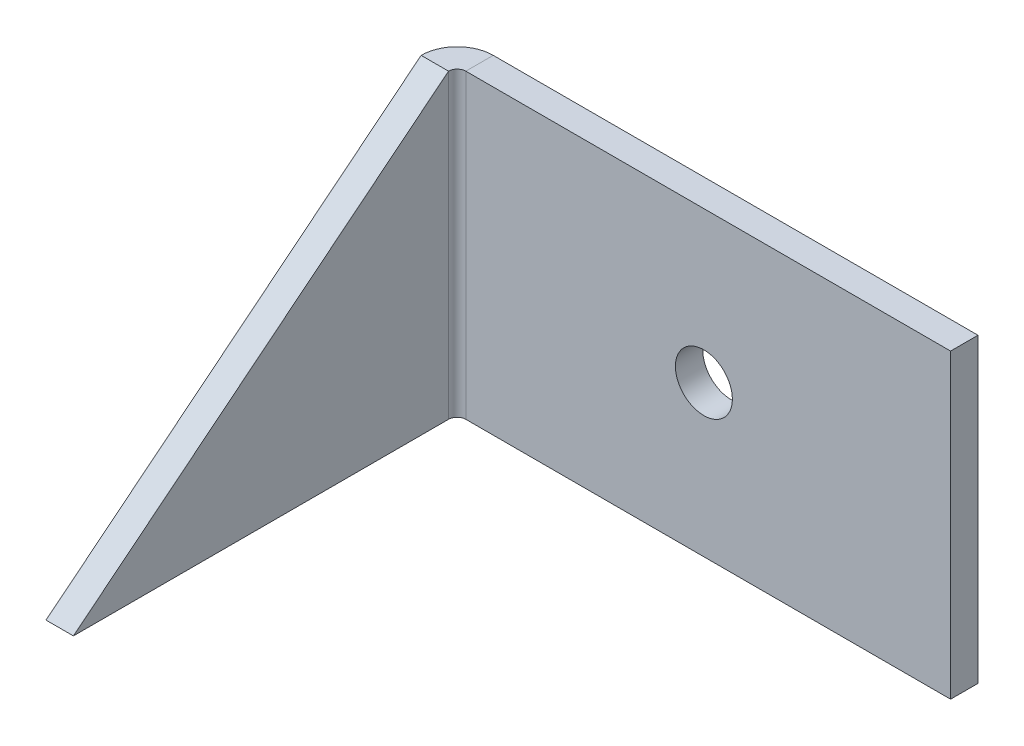
from build123d import *

# Parameters (mm, degrees)
SKETCH2_W                    = 57.15
SKETCH2_H                    = 34.925
BASE_FLANGE1_DEPTH           = 3.175
M6_CLEARANCE_HOLE1_D         = 6.6
EDGE_FLANGE2_STRIP_W         = 14.7
EDGE_FLANGE2_STRIP_H         = 3.175
EDGE_FLANGE2_STRIP_CUT_DEPTH = 34.925
EDGE_FLANGE2_DEPTH           = 34.925
CUT_EXTRUDE2_DEPTH           = 79.817416579


# Sheet-metal steps are written as plain solids
with BuildPart() as part:
    # Sketch2 → Base-Flange1 (new body)
    with BuildSketch(Plane.XY):
        Rectangle(SKETCH2_W, SKETCH2_H)
    extrude(amount=BASE_FLANGE1_DEPTH)

    # M6 Clearance Hole1 (through all)
    with Locations(Plane.XY.offset(3.175)):
        with Locations((0, 0)):
            Hole(M6_CLEARANCE_HOLE1_D / 2)

    # Edge-Flange2 strip (across the edge) → Edge-Flange2 strip cut (cut)
    with BuildSketch(Plane(origin=(-28.575, 17.4625, 3.175), x_dir=(1, 0, 0), z_dir=(0, -1, 0))):
        with Locations((-6.35, -1.5875)):
            Rectangle(EDGE_FLANGE2_STRIP_W, EDGE_FLANGE2_STRIP_H)
    extrude(amount=EDGE_FLANGE2_STRIP_CUT_DEPTH, mode=Mode.SUBTRACT)

    # Edge-Flange2 section (across the edge) → Edge-Flange2 (add)
    with BuildSketch(Plane(origin=(-28.575, 17.4625, 3.175), x_dir=(1, 0, 0), z_dir=(0, -1, 0))):
        with BuildLine():
            Line((-3.175, 1), (-3.175, 44.45))
            Line((-3.175, 44.45), (0, 44.45))
            Line((0, 44.45), (0, 1))
            ThreePointArc((0, 1), (0.292893219, 0.292893219), (1, 0))
            Line((1, 0), (1, -3.175))
            ThreePointArc((1, -3.175), (-1.952170811, -1.952170811), (-3.175, 1))
        make_face()
    extrude(amount=EDGE_FLANGE2_DEPTH)

    # Sketch20 → Cut-Extrude2 (cut, through all)
    with BuildSketch(Plane.ZY.offset(31.75)):
        Polygon((4.175, 17.4625), (47.625, -17.4625), (47.625, 17.4625), align=None)
    extrude(amount=-CUT_EXTRUDE2_DEPTH, mode=Mode.SUBTRACT)


solid = part.part
